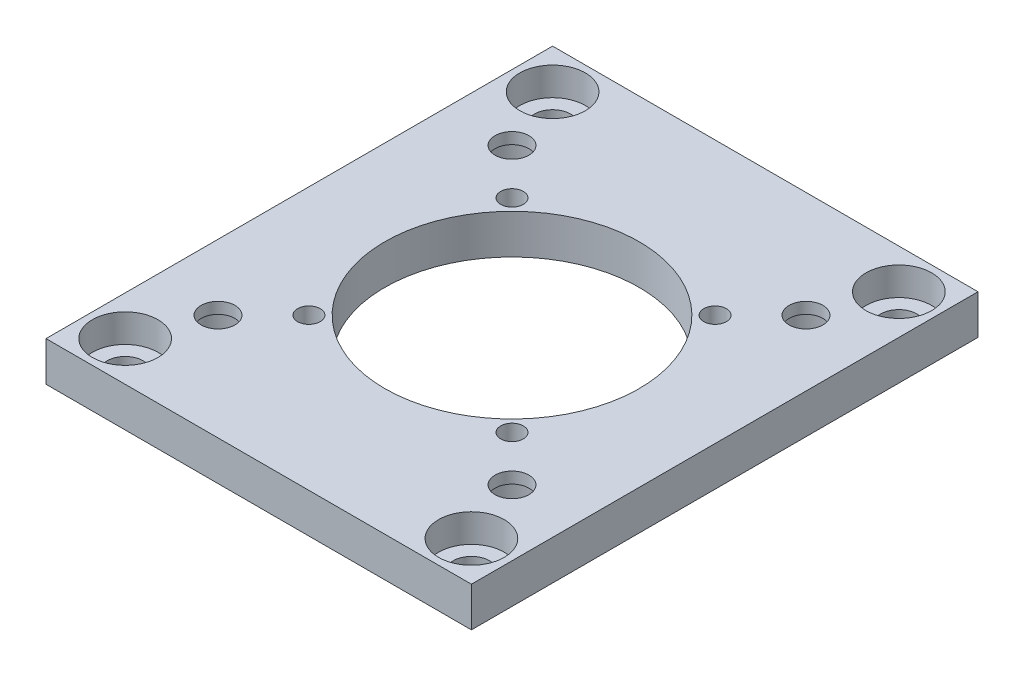
from build123d import *

# Parameters (mm, degrees)
SKETCH2_W           = 37.621859492
SKETCH2_H           = 44.8
SKETCH2_R           = 11.25
SKETCH2_R_2         = 1.5
SKETCH2_R_3         = 1
SKETCH2_R_4         = 1.6
BOSS_EXTRUDE1_DEPTH = 3.5
SKETCH4_R           = 2.9
CUT_EXTRUDE1_DEPTH  = 2.5
CUT_EXTRUDE2_START  = -2.5
SKETCH6_R           = 2.9
SKETCH6_R_2         = 1.6
CUT_EXTRUDE2_DEPTH  = 2.5


with BuildPart() as part:
    # Sketch2 → Boss-Extrude1 (new body)
    with BuildSketch(Plane(origin=(0, 0, 0), x_dir=(1, 0, 0), z_dir=(0, 1, 0))):
        Rectangle(SKETCH2_W, SKETCH2_H)
        Circle(SKETCH2_R, mode=Mode.SUBTRACT)
        with Locations((-13, 13)):
            Circle(SKETCH2_R_2, mode=Mode.SUBTRACT)
        with Locations((13, 13)):
            Circle(SKETCH2_R_2, mode=Mode.SUBTRACT)
        with Locations((13, -13)):
            Circle(SKETCH2_R_2, mode=Mode.SUBTRACT)
        with Locations((-13, -13)):
            Circle(SKETCH2_R_2, mode=Mode.SUBTRACT)
        with Locations((8.98, 8.98)):
            Circle(SKETCH2_R_3, mode=Mode.SUBTRACT)
        with Locations((-8.98, 8.98)):
            Circle(SKETCH2_R_3, mode=Mode.SUBTRACT)
        with Locations((8.98, -8.98)):
            Circle(SKETCH2_R_3, mode=Mode.SUBTRACT)
        with Locations((-8.98, -8.98)):
            Circle(SKETCH2_R_3, mode=Mode.SUBTRACT)
        with Locations((-15.31, 18.9)):
            Circle(SKETCH2_R_4, mode=Mode.SUBTRACT)
        with Locations((15.31, 18.9)):
            Circle(SKETCH2_R_4, mode=Mode.SUBTRACT)
        with Locations((15.31, -18.9)):
            Circle(SKETCH2_R_4, mode=Mode.SUBTRACT)
        with Locations((-15.31, -18.9)):
            Circle(SKETCH2_R_4, mode=Mode.SUBTRACT)
    extrude(amount=BOSS_EXTRUDE1_DEPTH)

    # Sketch4 → Cut-Extrude1 (cut)
    with BuildSketch(Plane.XZ):
        with Locations((-13, -13)):
            Circle(SKETCH4_R)
        with Locations((13, -13)):
            Circle(SKETCH4_R)
        with Locations((13, 13)):
            Circle(SKETCH4_R)
        with Locations((-13, 13)):
            Circle(SKETCH4_R)
    extrude(amount=-CUT_EXTRUDE1_DEPTH, mode=Mode.SUBTRACT)

    # Sketch6 → Cut-Extrude2 (cut)
    # profile 1 of 4: a face of its own
    with BuildSketch(Plane(origin=(0, 3.5, 0), x_dir=(1, 0, 0), z_dir=(0, 1, 0)).offset(CUT_EXTRUDE2_START)):
        with Locations((-15.31, 18.9)):
            Circle(SKETCH6_R)
        with Locations((-15.31, 18.9)):
            Circle(SKETCH6_R_2, mode=Mode.SUBTRACT)
    # profile 2 of 4: a face of its own
    with BuildSketch(Plane(origin=(0, 3.5, 0), x_dir=(1, 0, 0), z_dir=(0, 1, 0)).offset(CUT_EXTRUDE2_START)):
        with Locations((15.31, -18.9)):
            Circle(SKETCH6_R)
        with Locations((15.31, -18.9)):
            Circle(SKETCH6_R_2, mode=Mode.SUBTRACT)
    # profile 3 of 4: a face of its own
    with BuildSketch(Plane(origin=(0, 3.5, 0), x_dir=(1, 0, 0), z_dir=(0, 1, 0)).offset(CUT_EXTRUDE2_START)):
        with Locations((15.309998981, 18.900002337)):
            Circle(SKETCH6_R)
        with Locations((15.31, 18.9)):
            Circle(SKETCH6_R_2, mode=Mode.SUBTRACT)
    # profile 4 of 4: a face of its own
    with BuildSketch(Plane(origin=(0, 3.5, 0), x_dir=(1, 0, 0), z_dir=(0, 1, 0)).offset(CUT_EXTRUDE2_START)):
        with Locations((-15.31, -18.9)):
            Circle(SKETCH6_R)
        with Locations((-15.31, -18.9)):
            Circle(SKETCH6_R_2, mode=Mode.SUBTRACT)
    extrude(amount=CUT_EXTRUDE2_DEPTH, mode=Mode.SUBTRACT)


solid = part.part
